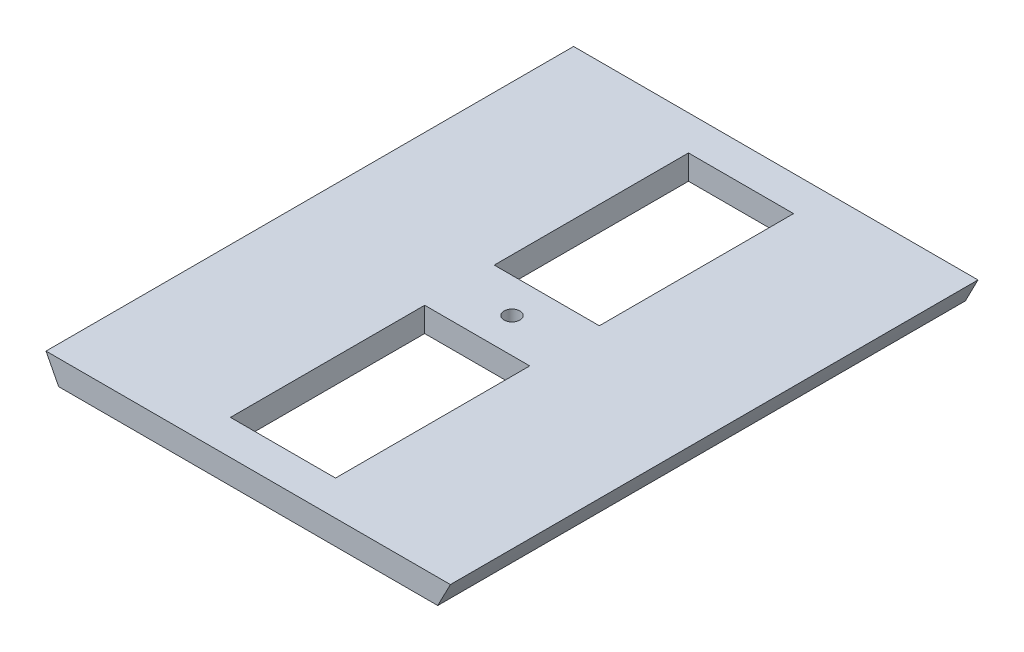
from build123d import *

# Parameters (mm, degrees)
BOSS_EXTRUDE2_DEPTH = 331.382
SKETCH3_R           = 5
SKETCH3_W           = 66
SKETCH3_H           = 122
CUT_EXTRUDE2_DEPTH  = 377.924435453
SKETCH4_W           = 240
SKETCH4_H           = 111.6
CUT_EXTRUDE3_DEPTH  = 377.924435453


with BuildPart() as part:
    # Sketch2 → Boss-Extrude2 (new body)
    with BuildSketch(Plane.XY):
        with BuildLine():
            Line((-127, 127), (127, 127))
            add(Edge.make_bspline(
                [(-127, 127), (0, -127), (127, 127)],
                knots=[0.056028396, 0.056028396, 0.056028396, 0.943971604, 0.943971604, 0.943971604], degree=2))
        make_face()
    extrude(amount=BOSS_EXTRUDE2_DEPTH)

    # Sketch3 → Cut-Extrude2 (cut, through all)
    with BuildSketch(Plane(origin=(0, 127, 0), x_dir=(1, 0, 0), z_dir=(0, 1, 0))):
        with Locations((0, -165.691)):
            Circle(SKETCH3_R)
        with Locations((0, -82.8455)):
            Rectangle(SKETCH3_W, SKETCH3_H)
        with Locations((0, -248.5365)):
            Rectangle(SKETCH3_W, SKETCH3_H)
    extrude(amount=-CUT_EXTRUDE2_DEPTH, mode=Mode.SUBTRACT)

    # Sketch4 → Cut-Extrude3 (cut, through all)
    with BuildSketch(Plane(origin=(0, 0, 0), x_dir=(-1, 0, 0), z_dir=(0, 0, -1))):
        with Locations((0, 55.8)):
            Rectangle(SKETCH4_W, SKETCH4_H)
    extrude(amount=-CUT_EXTRUDE3_DEPTH, mode=Mode.SUBTRACT)


solid = part.part
